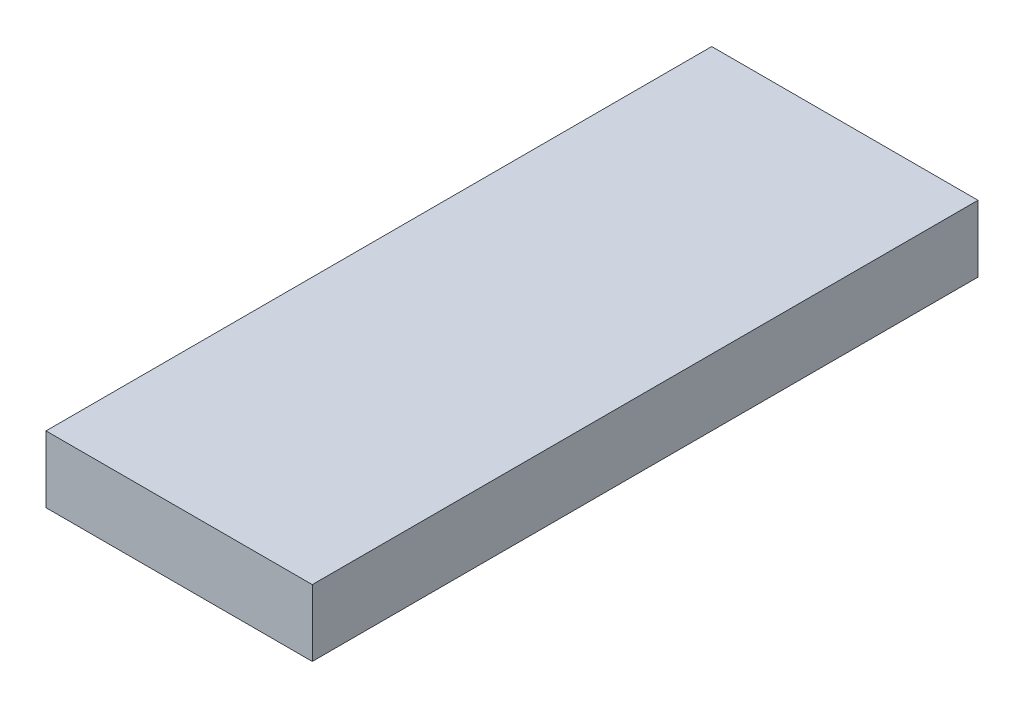
from build123d import *

# Parameters (mm, degrees)
SKETCH1_W           = 50.8
SKETCH1_H           = 127
BOSS_EXTRUDE1_DEPTH = 12.7


with BuildPart() as part:
    # Sketch1 → Boss-Extrude1 (new body)
    with BuildSketch(Plane(origin=(0, 0, 0), x_dir=(1, 0, 0), z_dir=(0, 1, 0))):
        with Locations((25.4, 63.5)):
            Rectangle(SKETCH1_W, SKETCH1_H)
    extrude(amount=BOSS_EXTRUDE1_DEPTH)


solid = part.part
